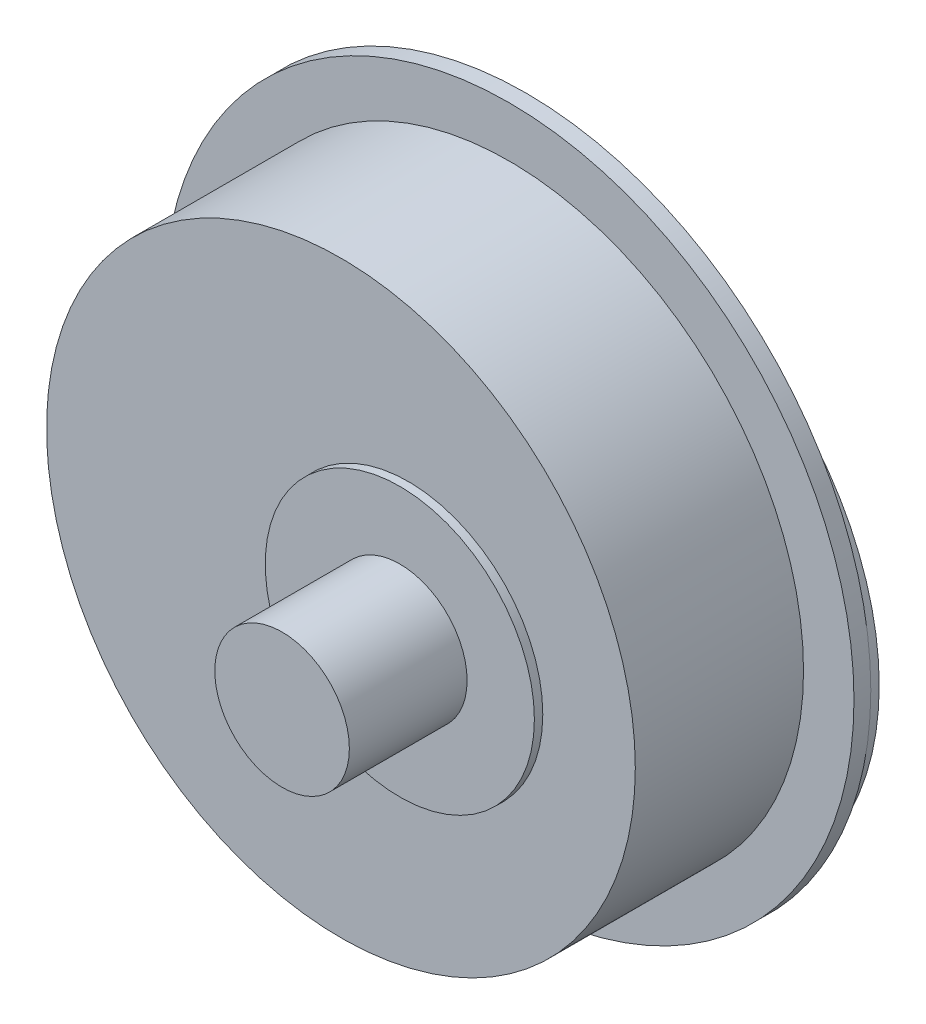
from build123d import *
from build123d.topology import SkipClean

# Parameters (mm, degrees)
SKETCH1_R           = 17.5
BOSS_EXTRUDE1_DEPTH = 5
SKETCH6_R           = 17.5
BOSS_EXTRUDE7_DEPTH = 5
BOSS_EXTRUDE3_START = 1
SKETCH3_R           = 20.5
BOSS_EXTRUDE3_DEPTH = 1
SKETCH4_R           = 8
BOSS_EXTRUDE5_DEPTH = 0.5
SKETCH5_R           = 4
BOSS_EXTRUDE6_DEPTH = 7
BOSS_EXTRUDE8_START = 0.5
SKETCH7_R           = 16.5
BOSS_EXTRUDE8_DEPTH = 0.5


with BuildPart() as part:
    # Sketch1 → Boss-Extrude1 (new body)
    with BuildSketch(Plane.XY):
        with Locations((-4, 0)):
            Circle(SKETCH1_R)
        with BuildLine():
            Line((-5, -6.244997998), (-5, 6.244997998))
            ThreePointArc((-5, 6.244997998), (8, 0), (-5, -6.244997998))
        make_face(mode=Mode.SUBTRACT)
    extrude(amount=BOSS_EXTRUDE1_DEPTH)

    # Sketch6 → Boss-Extrude7 (add)
    with BuildSketch(Plane.XY.offset(5)):
        with Locations((-4, 0)):
            Circle(SKETCH6_R)
    extrude(amount=BOSS_EXTRUDE7_DEPTH)

    # Sketch3 → Boss-Extrude3 (add)
    with SkipClean():  # the faces are left unmerged after this step: merging them gives an invalid solid
        with BuildSketch(Plane(origin=(0, 0, 0), x_dir=(-1, 0, 0), z_dir=(0, 0, -1)).offset(BOSS_EXTRUDE3_START)):
            with Locations((4, 0)):
                Circle(SKETCH3_R)
            with BuildLine():
                Line((5, 6.244997998), (5, -6.244997998))
                ThreePointArc((5, -6.244997998), (-8, 0), (5, 6.244997998))
            make_face(mode=Mode.SUBTRACT)
        extrude(amount=-BOSS_EXTRUDE3_DEPTH)

    # Sketch4 → Boss-Extrude5 (add)
    with SkipClean():  # the faces are left unmerged after this step: merging them gives an invalid solid
        with BuildSketch(Plane.XY.offset(10)):
            Circle(SKETCH4_R)
        extrude(amount=BOSS_EXTRUDE5_DEPTH)

    # Sketch5 → Boss-Extrude6 (add)
    with SkipClean():  # the faces are left unmerged after this step: merging them gives an invalid solid
        with BuildSketch(Plane.XY.offset(10.5)):
            Circle(SKETCH5_R)
        extrude(amount=BOSS_EXTRUDE6_DEPTH)

    # Sketch7 → Boss-Extrude8 (add)
    with SkipClean():  # the faces are left unmerged after this step: merging them gives an invalid solid
        with BuildSketch(Plane(origin=(0, 0, -1), x_dir=(-1, 0, 0), z_dir=(0, 0, -1)).offset(BOSS_EXTRUDE8_START)):
            Circle(SKETCH7_R)
            with BuildLine():
                Line((5, 6.244997998), (5, -6.244997998))
                ThreePointArc((5, -6.244997998), (-8, 0), (5, 6.244997998))
            make_face(mode=Mode.SUBTRACT)
        extrude(amount=-BOSS_EXTRUDE8_DEPTH)


solid = part.part
